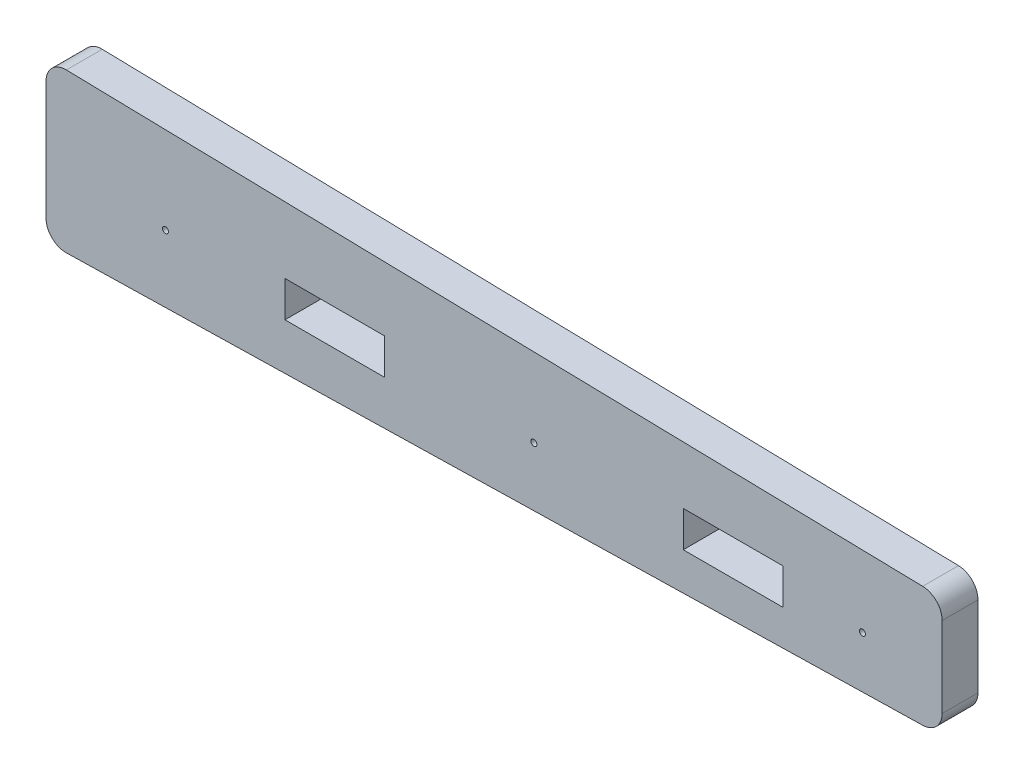
from build123d import *

# Parameters (mm, degrees)
SKETCH1_W              = 50
SKETCH1_H              = 18
EXTRUDE_585_DEPTH      = 18
FILLET1_R              = 10
CUT_EXTRUDE_1188_REACH = 231.197
SKETCH2_R              = 1.5


with BuildPart() as part:
    # Sketch1 → Extrude 585 (new body)
    with BuildSketch(Plane.XY):
        Polygon((-225, 40), (-225, -40), (225, -30), (225, 30), align=None)
        with Locations((-80, -5)):
            Rectangle(SKETCH1_W, SKETCH1_H, mode=Mode.SUBTRACT)
        with Locations((120, -5)):
            Rectangle(SKETCH1_W, SKETCH1_H, mode=Mode.SUBTRACT)
    extrude(amount=EXTRUDE_585_DEPTH)

    # Fillet1
    fillet1_edges = [part.edges().sort_by_distance(p)[0] for p in [
        (-225, -40, 9),
        (-225, 40, 9),
        (225, -30, 9),
        (225, 30, 9),
    ]]
    fillet(fillet1_edges, radius=FILLET1_R)

    # Sketch2 → Cut-Extrude 1188 (cut, up to next)
    with BuildSketch(Plane.XY.offset(18), mode=Mode.PRIVATE) as cut_extrude_1188_sk1:
        with Locations((-165, -5)):
            Circle(SKETCH2_R)
    cut_extrude_1188_tool1 = extrude(cut_extrude_1188_sk1.sketch, amount=-CUT_EXTRUDE_1188_REACH, mode=Mode.PRIVATE) & part.part
    # Sketch2 → Cut-Extrude 1188 (cut, up to next)
    with BuildSketch(Plane.XY.offset(18), mode=Mode.PRIVATE) as cut_extrude_1188_sk2:
        with Locations((20, -5)):
            Circle(SKETCH2_R)
    cut_extrude_1188_tool2 = extrude(cut_extrude_1188_sk2.sketch, amount=-CUT_EXTRUDE_1188_REACH, mode=Mode.PRIVATE) & part.part
    # Sketch2 → Cut-Extrude 1188 (cut, up to next)
    with BuildSketch(Plane.XY.offset(18), mode=Mode.PRIVATE) as cut_extrude_1188_sk3:
        with Locations((185, -5)):
            Circle(SKETCH2_R)
    cut_extrude_1188_tool3 = extrude(cut_extrude_1188_sk3.sketch, amount=-CUT_EXTRUDE_1188_REACH, mode=Mode.PRIVATE) & part.part
    add(cut_extrude_1188_tool1.solids().sort_by_distance((-165, -5, 18))[0], mode=Mode.SUBTRACT)
    add(cut_extrude_1188_tool2.solids().sort_by_distance((20, -5, 18))[0], mode=Mode.SUBTRACT)
    add(cut_extrude_1188_tool3.solids().sort_by_distance((185, -5, 18))[0], mode=Mode.SUBTRACT)


solid = part.part
